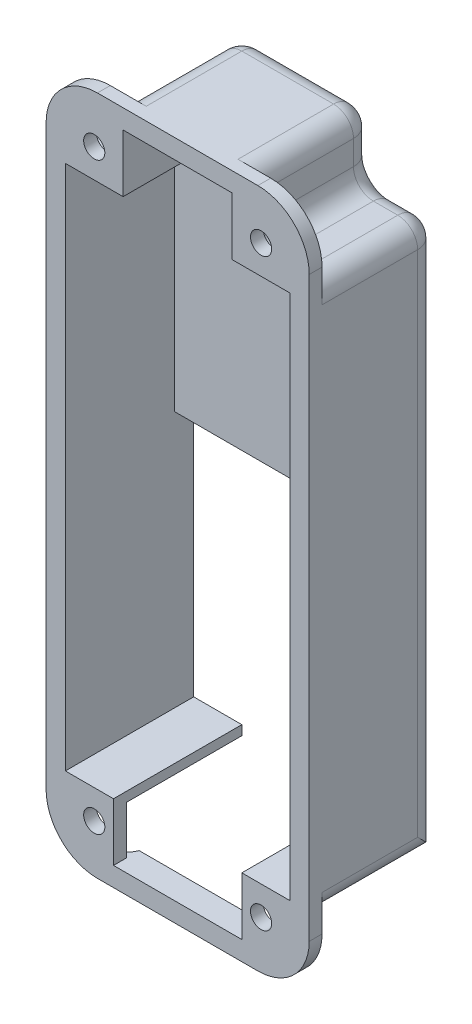
from build123d import *

# Parameters (mm, degrees)
SKETCH_2_W          = 41
SKETCH_2_H          = 106
SKETCH_2_R          = 1.65
EXTRUDE_3_DEPTH     = 17
SKETCH_5_R          = 1.65
CUT_EXTRUDE_2_DEPTH = 112.094554322
SKETCH_6_W          = 41
SKETCH_6_H          = 106
EXTRUDE_4_DEPTH     = 3
CUT_EXTRUDE_START   = -2
SKETCH_7_W          = 10.5
SKETCH_7_H          = 10.5
SKETCH_7_W_2        = 10
SKETCH_7_H_2        = 10
CUT_EXTRUDE_3_DEPTH = 110.593010534
SKETCH_9_W          = 1.5
SKETCH_9_H          = 9
CUT_EXTRUDE_4_DEPTH = 112.593010534
SKETCH_10_R         = 3.5
CUT_EXTRUDE_7_DEPTH = 112.094554322
SKETCH_12_W         = 20
SKETCH_12_H         = 3
CUT_EXTRUDE_8_DEPTH = 16
CUT_EXTRUDE_9_DEPTH = 112.094554322
FILLET_1_R          = 3.1
FILLET_2_R          = 3.1
FILLET_3_R          = 3.1
FILLET_4_R          = 8


with BuildPart() as part:
    # 草图2 → 凸台-拉伸3 (new body)
    with BuildSketch(Plane.XY):
        with Locations((17.5, 50)):
            Rectangle(SKETCH_2_W, SKETCH_2_H)
        Polygon((9, 0), (9, 9), (0, 9), (0, 91), (9, 91), (9, 100), (26, 100), (26, 91), (35, 91), (35, 9), (26, 9), (26, 0), align=None, mode=Mode.SUBTRACT)
        with Locations((4.5, 4.5)):
            Circle(SKETCH_2_R, mode=Mode.SUBTRACT)
        with Locations((4.5, 95.5)):
            Circle(SKETCH_2_R, mode=Mode.SUBTRACT)
        with Locations((30.5, 95.5)):
            Circle(SKETCH_2_R, mode=Mode.SUBTRACT)
    extrude(amount=EXTRUDE_3_DEPTH)

    # 草图5 → 切除-拉伸2 (cut, through all)
    with BuildSketch(Plane.XY.offset(17)):
        with Locations((30.5, 4.5)):
            Circle(SKETCH_5_R)
    extrude(amount=-CUT_EXTRUDE_2_DEPTH, mode=Mode.SUBTRACT)

    # 草图6 → 凸台-拉伸4 (add)
    with BuildSketch(Plane(origin=(0, 0, 0), x_dir=(-1, 0, 0), z_dir=(0, 0, -1))):
        with Locations((-17.5, 50)):
            Rectangle(SKETCH_6_W, SKETCH_6_H)
    extrude(amount=EXTRUDE_4_DEPTH)

    # 草图7 → 切除-拉伸3 (cut, through all)
    with BuildSketch(Plane.XY.offset(17).offset(CUT_EXTRUDE_START)):
        with Locations((2.25, 97.75)):
            Rectangle(SKETCH_7_W, SKETCH_7_H)
        with Locations((33, 98)):
            Rectangle(SKETCH_7_W_2, SKETCH_7_H_2)
        with Locations((2.25, 2.25)):
            Rectangle(SKETCH_7_W, SKETCH_7_H)
        with Locations((32.75, 2.25)):
            Rectangle(SKETCH_7_W, SKETCH_7_H)
    extrude(amount=-CUT_EXTRUDE_3_DEPTH, mode=Mode.SUBTRACT)

    # 草图9 → 切除-拉伸4 (cut, through all)
    with BuildSketch(Plane.XY.offset(17)):
        with Locations((8.25, 4.5)):
            Rectangle(SKETCH_9_W, SKETCH_9_H)
        with Locations((26.75, 4.5)):
            Rectangle(SKETCH_9_W, SKETCH_9_H)
    extrude(amount=-CUT_EXTRUDE_4_DEPTH, mode=Mode.SUBTRACT)

    # 草图10 → 切除-拉伸7 (cut, through all)
    with BuildSketch(Plane.XY):
        with Locations((28.5, 83.63)):
            Circle(SKETCH_10_R)
    extrude(amount=-CUT_EXTRUDE_7_DEPTH, mode=Mode.SUBTRACT)

    # 草图12 → 切除-拉伸8 (cut)
    with BuildSketch(Plane(origin=(0, 0, -3), x_dir=(-1, 0, 0), z_dir=(0, 0, -1))):
        with Locations((-17.5, -1.5)):
            Rectangle(SKETCH_12_W, SKETCH_12_H)
    extrude(amount=-CUT_EXTRUDE_8_DEPTH, mode=Mode.SUBTRACT)

    # 草图13 → 切除-拉伸9 (cut, through all)
    with BuildSketch(Plane.XY):
        Polygon((0, 49), (0, 9), (9, 9), (9, 0), (26, 0), (26, 9), (35, 9), (35, 61), (26, 61), (26, 49), align=None)
    extrude(amount=-CUT_EXTRUDE_9_DEPTH, mode=Mode.SUBTRACT)

    # 圆角1
    # the kernel refuses this fillet: 3.1 mm, written as the material it takes off along each edge
    with BuildSketch(Plane(origin=(-3, 100.25, -3), x_dir=(0, 0, 1), z_dir=(0, -1, 0))) as fillet_1_piece_1:
        with BuildLine():
            CenterArc((FILLET_1_R, -FILLET_1_R), FILLET_1_R, 90, 90)
            Line((0, -FILLET_1_R), (0, 0))
            Line((0, 0), (FILLET_1_R, 0))
        make_face()
    extrude(amount=100.5, mode=Mode.SUBTRACT)
    with BuildSketch(Plane(origin=(38, -0.25, -3), x_dir=(0, 0, 1), z_dir=(0, 1, 0))) as fillet_1_piece_2:
        with BuildLine():
            CenterArc((FILLET_1_R, -FILLET_1_R), FILLET_1_R, 90, 90)
            Line((0, -FILLET_1_R), (0, 0))
            Line((0, 0), (FILLET_1_R, 0))
        make_face()
    extrude(amount=101, mode=Mode.SUBTRACT)

    # 圆角2
    # the kernel refuses this fillet: 3.1 mm, written as the material it adds along each edge
    with BuildSketch(Plane(origin=(7.5, -3, 15), x_dir=(-1, 0, 0), z_dir=(0, 1, 0))) as fillet_2_piece_1:
        with BuildLine():
            CenterArc((2.898275349, -3.1), FILLET_2_R, 90, 69.216440404)
            Line((0, -2), (0, 0))
            Line((0, 0), (2.898275349, 0))
        make_face()
    extrude(amount=3)
    with BuildSketch(Plane(origin=(27.5, -3, 15), x_dir=(0, 0, -1), z_dir=(0, 1, 0))) as fillet_2_piece_2:
        with BuildLine():
            CenterArc((3.1, -2.898275349), FILLET_2_R, 110.783559596, 69.216440404)
            Line((0, -2.898275349), (0, 0))
            Line((0, 0), (2, 0))
        make_face()
    extrude(amount=3)
    with BuildSketch(Plane(origin=(28, 93, 15), x_dir=(0, 1, 0), z_dir=(0, 0, -1))) as fillet_2_piece_3:
        with BuildLine():
            CenterArc((FILLET_2_R, FILLET_2_R), FILLET_2_R, 180, 90)
            Line((0, FILLET_2_R), (0, 0))
            Line((0, 0), (FILLET_2_R, 0))
        make_face()
    extrude(amount=18)
    with BuildSketch(Plane(origin=(7.5, 92.5, 22.75), x_dir=(-1, 0, 0), z_dir=(0, 0, -1))) as fillet_2_piece_4_section:
        with BuildLine():
            CenterArc((FILLET_2_R, FILLET_2_R), FILLET_2_R, 180, 90)
            Line((0, FILLET_2_R), (0, 0))
            Line((0, 0), (FILLET_2_R, 0))
        make_face()
    fillet_2_piece_4 = extrude(amount=25.75, mode=Mode.PRIVATE)
    fillet_2_piece_4 = split(fillet_2_piece_4, bisect_by=Plane(origin=(6.807559389, 93.192440611, 17), z_dir=(0, 0, -1)), keep=Keep.TOP, mode=Mode.PRIVATE)
    add(fillet_2_piece_4)

    # 圆角3
    # the kernel refuses this fillet: 3.1 mm, written as the material it takes off along each edge
    with BuildSketch(Plane(origin=(10.6, 99.9, 0.1), x_dir=(0, 0, -1), z_dir=(0, 1, 0))) as fillet_3_piece_1_section:
        Polygon((0, 0), (FILLET_3_R * 1.02, 0), (FILLET_3_R * 1.02, FILLET_3_R * 1.02), (0, FILLET_3_R * 1.02), align=None)
    fillet_3_piece_1 = extrude(amount=FILLET_3_R * 1.02, mode=Mode.PRIVATE)
    fillet_3_piece_1 = fillet_3_piece_1 - Plane(origin=(10.6, 99.9, 0.1), x_dir=(0.7071067811865475, 0, 0.7071067811865475), z_dir=(0, 1, 0)) * Sphere(FILLET_3_R, mode=Mode.PRIVATE)
    add(fillet_3_piece_1, mode=Mode.SUBTRACT)
    with BuildSketch(Plane(origin=(24.9, 99.9, 0.1), x_dir=(1, 0, 0), z_dir=(0, 1, 0))) as fillet_3_piece_2_section:
        Polygon((0, 0), (FILLET_3_R * 1.02, 0), (FILLET_3_R * 1.02, FILLET_3_R * 1.02), (0, FILLET_3_R * 1.02), align=None)
    fillet_3_piece_2 = extrude(amount=FILLET_3_R * 1.02, mode=Mode.PRIVATE)
    fillet_3_piece_2 = fillet_3_piece_2 - Plane(origin=(24.9, 99.9, 0.1), x_dir=(-0.7071067811865475, 0, 0.7071067811865475), z_dir=(0, 1, 0)) * Sphere(FILLET_3_R, mode=Mode.PRIVATE)
    add(fillet_3_piece_2, mode=Mode.SUBTRACT)
    with BuildSketch(Plane(origin=(7.5, 99.9, -3), x_dir=(1, 0, 0), z_dir=(0, -1, 0))) as fillet_3_piece_3:
        with BuildLine():
            CenterArc((FILLET_3_R, FILLET_3_R), FILLET_3_R, 180, 90)
            Line((0, FILLET_3_R), (0, 0))
            Line((0, 0), (FILLET_3_R, 0))
        make_face()
    extrude(amount=4.3, mode=Mode.SUBTRACT)
    with BuildSketch(Plane(origin=(4.4, 95.6, -3), x_dir=(1, 0, 0), z_dir=(0, 1, 0))) as fillet_3_piece_4:
        with BuildLine():
            CenterArc((3.1 + FILLET_3_R, -FILLET_3_R), FILLET_3_R, 90, 90)
            Line((3.1, -FILLET_3_R), (3.1, 0))
            Line((3.1, 0), (3.1 + FILLET_3_R, 0))
        make_face()
    revolve(axis=Axis((4.4, 95.6, -3), (0, 0, -1)), revolution_arc=90, mode=Mode.SUBTRACT)
    with BuildSketch(Plane(origin=(4.4, 92.5, -3), x_dir=(0, 0, 1), z_dir=(-1, 0, 0))) as fillet_3_piece_5:
        with BuildLine():
            CenterArc((FILLET_3_R, -FILLET_3_R), FILLET_3_R, 90, 90)
            Line((0, -FILLET_3_R), (0, 0))
            Line((0, 0), (FILLET_3_R, 0))
        make_face()
    extrude(amount=4.3, mode=Mode.SUBTRACT)
    with BuildSketch(Plane(origin=(0.1, 92.5, 0.1), x_dir=(0, 0, -1), z_dir=(1, 0, 0))) as fillet_3_piece_6:
        with BuildLine():
            CenterArc((3.1 - FILLET_3_R, -FILLET_3_R), FILLET_3_R, 0, 90)
            Line((3.1, -FILLET_3_R), (3.1, 0))
            Line((3.1, 0), (3.1 - FILLET_3_R, 0))
        make_face()
    revolve(axis=Axis((0.1, 92.5, 0.1), (0, 1, 0)), revolution_arc=90, mode=Mode.SUBTRACT)
    with BuildSketch(Plane(origin=(28, 99.9, -3), x_dir=(0, 0, 1), z_dir=(0, -1, 0))) as fillet_3_piece_7:
        with BuildLine():
            CenterArc((FILLET_3_R, FILLET_3_R), FILLET_3_R, 180, 90)
            Line((0, FILLET_3_R), (0, 0))
            Line((0, 0), (FILLET_3_R, 0))
        make_face()
    extrude(amount=3.8, mode=Mode.SUBTRACT)
    with BuildSketch(Plane(origin=(31.1, 96.1, -3), x_dir=(0, -1, 0), z_dir=(1, 0, 0))) as fillet_3_piece_8:
        with BuildLine():
            CenterArc((3.1 + FILLET_3_R, -FILLET_3_R), FILLET_3_R, 90, 90)
            Line((3.1, -FILLET_3_R), (3.1, 0))
            Line((3.1, 0), (3.1 + FILLET_3_R, 0))
        make_face()
    revolve(axis=Axis((31.1, 96.1, -3), (0, 0, -1)), revolution_arc=90, mode=Mode.SUBTRACT)
    with BuildSketch(Plane(origin=(31.1, 93, -3), x_dir=(0, -1, 0), z_dir=(1, 0, 0))) as fillet_3_piece_9:
        with BuildLine():
            CenterArc((FILLET_3_R, -FILLET_3_R), FILLET_3_R, 90, 90)
            Line((0, -FILLET_3_R), (0, 0))
            Line((0, 0), (FILLET_3_R, 0))
        make_face()
    extrude(amount=3.8, mode=Mode.SUBTRACT)
    with BuildSketch(Plane(origin=(34.9, 93, 0.1), x_dir=(0, 0, -1), z_dir=(-1, 0, 0))) as fillet_3_piece_10:
        with BuildLine():
            CenterArc((3.1 - FILLET_3_R, FILLET_3_R), FILLET_3_R, 270, 90)
            Line((3.1 - FILLET_3_R, 0), (3.1, 0))
            Line((3.1, 0), (3.1, FILLET_3_R))
        make_face()
    revolve(axis=Axis((34.9, 93, 0.1), (0, -1, 0)), revolution_arc=90, mode=Mode.SUBTRACT)
    with BuildSketch(Plane(origin=(28, 103, 15), x_dir=(-1, 0, 0), z_dir=(0, 0, -1)), Plane(origin=(-3, 92.5, 15), x_dir=(0, -1, 0), z_dir=(0, 0, -1))) as fillet_3_piece_11:
        with BuildLine():
            CenterArc((FILLET_3_R, -FILLET_3_R), FILLET_3_R, 90, 90)
            Line((0, -FILLET_3_R), (0, 0))
            Line((0, 0), (FILLET_3_R, 0))
        make_face()
    extrude(amount=14.9, mode=Mode.SUBTRACT)
    with BuildSketch(Plane(origin=(7.5, 103, 15), x_dir=(1, 0, 0), z_dir=(0, 0, -1)), Plane(origin=(38, 93, 15), x_dir=(0, -1, 0), z_dir=(0, 0, -1))) as fillet_3_piece_12:
        with BuildLine():
            CenterArc((FILLET_3_R, FILLET_3_R), FILLET_3_R, 180, 90)
            Line((0, FILLET_3_R), (0, 0))
            Line((0, 0), (FILLET_3_R, 0))
        make_face()
    extrude(amount=14.9, mode=Mode.SUBTRACT)
    with BuildSketch(Plane(origin=(24.9, 103, -3), x_dir=(0, 0, 1), z_dir=(-1, 0, 0))) as fillet_3_piece_13:
        with BuildLine():
            CenterArc((FILLET_3_R, -FILLET_3_R), FILLET_3_R, 90, 90)
            Line((0, -FILLET_3_R), (0, 0))
            Line((0, 0), (FILLET_3_R, 0))
        make_face()
    extrude(amount=14.3, mode=Mode.SUBTRACT)
    with BuildSketch(Plane(origin=(-3, 7.5, 15), x_dir=(0, 1, 0), z_dir=(0, 0, -1))) as fillet_3_piece_14:
        with BuildLine():
            CenterArc((FILLET_3_R, FILLET_3_R), FILLET_3_R, 180, 90)
            Line((0, FILLET_3_R), (0, 0))
            Line((0, 0), (FILLET_3_R, 0))
        make_face()
    extrude(amount=22.65, mode=Mode.SUBTRACT)
    with BuildSketch(Plane(origin=(38, 7.5, 15), x_dir=(0, 1, 0), z_dir=(0, 0, -1))) as fillet_3_piece_15:
        with BuildLine():
            CenterArc((FILLET_3_R, -FILLET_3_R), FILLET_3_R, 90, 90)
            Line((0, -FILLET_3_R), (0, 0))
            Line((0, 0), (FILLET_3_R, 0))
        make_face()
    extrude(amount=22.65, mode=Mode.SUBTRACT)

    # 圆角4
    fillet_4_edges = [part.edges().sort_by_distance(p)[0] for p in [
        (-3, 103, 16),
        (38, 103, 16),
        (38, -3, 16),
        (-3, -3, 16),
    ]]
    fillet(fillet_4_edges, radius=FILLET_4_R)


solid = part.part
